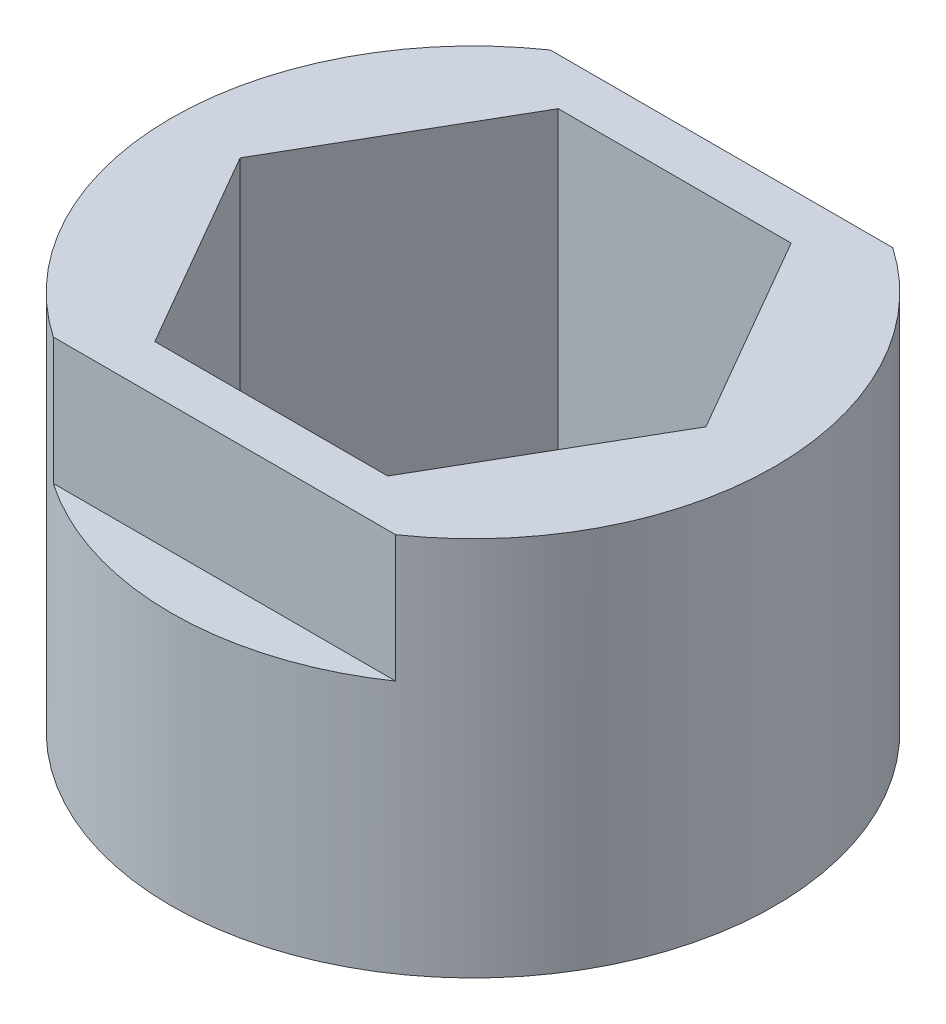
from build123d import *

# Parameters (mm, degrees)
SKETCH1_R               = 7.5565
BOSS_EXTRUDE1_DEPTH     = 8.89
BOSS_EXTRUDE2_START     = 0.635
SKETCH2_R               = 7.5565
SKETCH2_R_2             = 3.3
BOSS_EXTRUDE2_DEPTH     = 0.635
CUT_EXTRUDE1_DEPTH      = 14.900844741
CUT_EXTRUDE1_DEPTH_BACK = 14.900844741
SKETCH3_W               = 1.979009817
SKETCH3_H               = 3.81
SKETCH3_W_2             = 2.256055482


with BuildPart() as part:
    # Sketch1 → Boss-Extrude1 (new body)
    with BuildSketch(Plane(origin=(0, 0, 0), x_dir=(1, 0, 0), z_dir=(0, 1, 0))):
        Circle(SKETCH1_R)
        Polygon((-2.915618859, 5.05), (-5.831237719, 0), (-2.915618859, -5.05), (2.915618859, -5.05), (5.831237719, 0), (2.915618859, 5.05), align=None, mode=Mode.SUBTRACT)
    extrude(amount=BOSS_EXTRUDE1_DEPTH)

    # Sketch2 → Boss-Extrude2 (add)
    with BuildSketch(Plane.XZ.offset(BOSS_EXTRUDE2_START)):
        Circle(SKETCH2_R)
        Circle(SKETCH2_R_2, mode=Mode.SUBTRACT)
    extrude(amount=-BOSS_EXTRUDE2_DEPTH)

    # Sketch3 → Cut-Extrude1 (cut, two sides: drawn at the far end of the back side and taken through both)
    with BuildSketch(Plane(origin=(0, 0, 0), x_dir=(0, 0, -1), z_dir=(1, 0, 0)).offset(-CUT_EXTRUDE1_DEPTH_BACK)):
        with Locations((-7.212504909, 7.62)):
            Rectangle(SKETCH3_W, SKETCH3_H)
        with Locations((7.351027741, 7.62)):
            Rectangle(SKETCH3_W_2, SKETCH3_H)
    extrude(amount=CUT_EXTRUDE1_DEPTH + CUT_EXTRUDE1_DEPTH_BACK, mode=Mode.SUBTRACT)


solid = part.part
